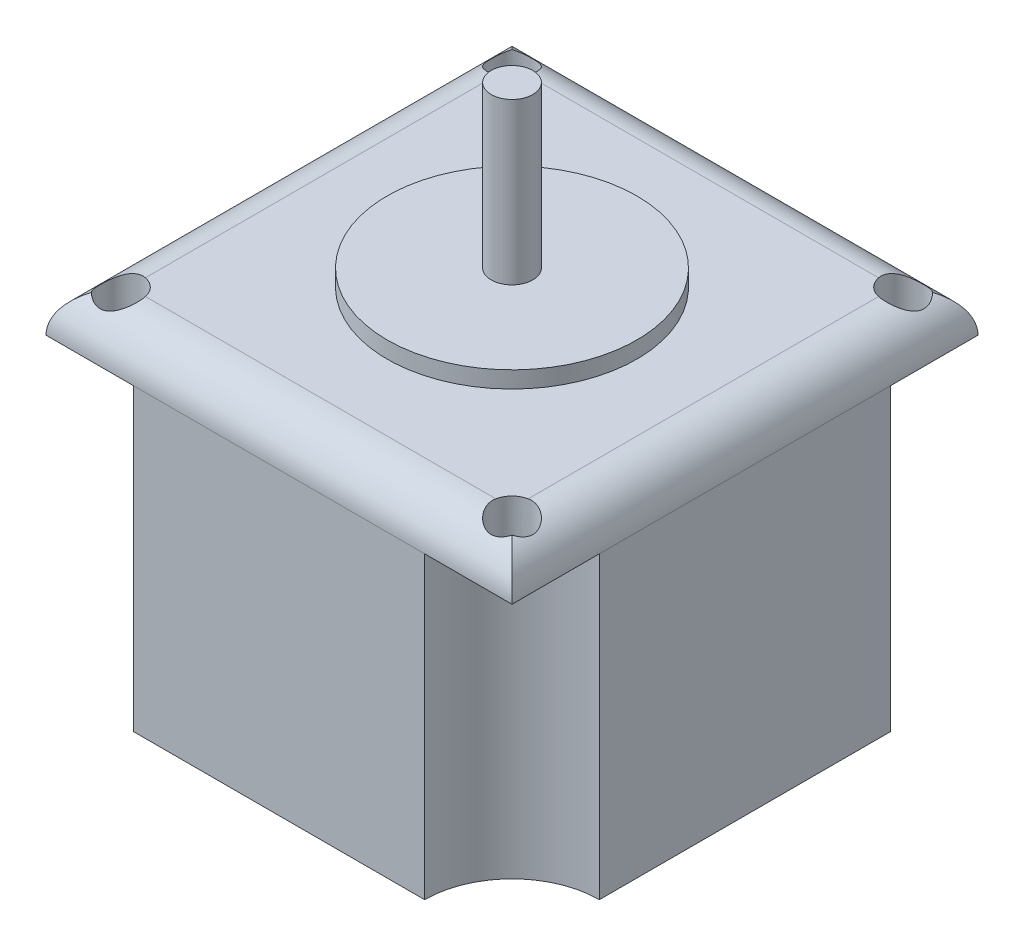
from build123d import *

# Parameters (mm, degrees)
SCHIZZO1_W                   = 56
SCHIZZO1_H                   = 56
ESTRUSIONE_ESTRUSIONE1_DEPTH = 41
SCHIZZO2_R                   = 2.5
TAGLIO_ESTRUSIONE1_DEPTH     = 41
SCHIZZO3_R                   = 15
ESTRUSIONE_ESTRUSIONE3_DEPTH = 2
SCHIZZO4_R                   = 2.5
ESTRUSIONE_ESTRUSIONE4_DEPTH = 19.3
SCHIZZO5_R                   = 10.5
TAGLIO_ESTRUSIONE2_DEPTH     = 36
CONG_1_R                     = 5


with BuildPart() as part:
    # Schizzo1 → Estrusione-Estrusione1 (new body)
    with BuildSketch(Plane(origin=(0, 0, 0), x_dir=(1, 0, 0), z_dir=(0, 1, 0))):
        Rectangle(SCHIZZO1_W, SCHIZZO1_H)
    extrude(amount=ESTRUSIONE_ESTRUSIONE1_DEPTH)

    # Schizzo2 → Taglio-Estrusione1 (cut)
    with BuildSketch(Plane(origin=(0, 41, 0), x_dir=(1, 0, 0), z_dir=(0, 1, 0))):
        with Locations(Location((-23.5, 23.5, 0), (0, 0, 270))):
            Circle(SCHIZZO2_R)
        with Locations(Location((23.5, 23.5, 0), (0, 0, 270))):
            Circle(SCHIZZO2_R)
        with Locations(Location((23.5, -23.5, 0), (0, 0, 270))):
            Circle(SCHIZZO2_R)
        with Locations(Location((-23.5, -23.5, 0), (0, 0, 270))):
            Circle(SCHIZZO2_R)
    extrude(amount=-TAGLIO_ESTRUSIONE1_DEPTH, mode=Mode.SUBTRACT)

    # Schizzo3 → Estrusione-Estrusione3 (add)
    with BuildSketch(Plane(origin=(0, 41, 0), x_dir=(1, 0, 0), z_dir=(0, 1, 0))):
        with Locations(Location((0, 0, 0), (0, 0, 90))):
            Circle(SCHIZZO3_R)
    extrude(amount=ESTRUSIONE_ESTRUSIONE3_DEPTH)

    # Schizzo4 → Estrusione-Estrusione4 (add)
    with BuildSketch(Plane(origin=(0, 43, 0), x_dir=(1, 0, 0), z_dir=(0, 1, 0))):
        with Locations(Location((0, 0, 0), (0, 0, 270))):
            Circle(SCHIZZO4_R)
    extrude(amount=ESTRUSIONE_ESTRUSIONE4_DEPTH)

    # Schizzo5 → Taglio-Estrusione2 (cut)
    with BuildSketch(Plane.XZ):
        with Locations((-28, 28)):
            Circle(SCHIZZO5_R)
        with Locations((28, 28)):
            Circle(SCHIZZO5_R)
        with Locations((28, -28)):
            Circle(SCHIZZO5_R)
        with Locations((-28, -28)):
            Circle(SCHIZZO5_R)
    extrude(amount=-TAGLIO_ESTRUSIONE2_DEPTH, mode=Mode.SUBTRACT)

    # Congé1
    # the kernel refuses this fillet: 5 mm, written as the material it takes off along each edge
    with BuildSketch(Plane(origin=(40.5, 41, -28), x_dir=(0, 0, 1), z_dir=(-1, 0, 0)), Plane(origin=(-28, 41, -40.5), x_dir=(1, 0, 0), z_dir=(0, 0, 1))) as cong_1_piece_1:
        with BuildLine():
            CenterArc((CONG_1_R, -CONG_1_R), CONG_1_R, 90, 90)
            Line((0, -CONG_1_R), (0, 0))
            Line((0, 0), (CONG_1_R, 0))
        make_face()
    extrude(amount=81, mode=Mode.SUBTRACT)
    with BuildSketch(Plane(origin=(-40.5, 41, 28), x_dir=(0, -1, 0), z_dir=(1, 0, 0)), Plane(origin=(28, 41, 40.5), x_dir=(0, -1, 0), z_dir=(0, 0, -1))) as cong_1_piece_2:
        with BuildLine():
            CenterArc((CONG_1_R, CONG_1_R), CONG_1_R, 180, 90)
            Line((0, CONG_1_R), (0, 0))
            Line((0, 0), (CONG_1_R, 0))
        make_face()
    extrude(amount=81, mode=Mode.SUBTRACT)


solid = part.part
